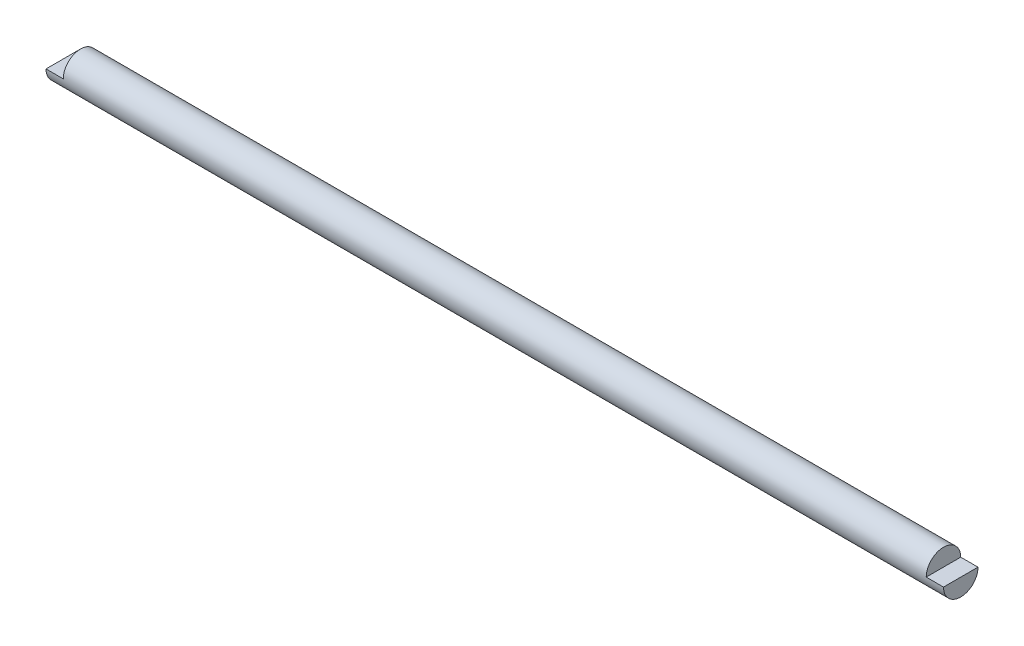
from build123d import *

# Parameters (mm, degrees)
SKETCH1_R               = 6.35
BOSS_EXTRUDE1_DEPTH     = 330.2
CUT_EXTRUDE1_DEPTH      = 331.322092812
CUT_EXTRUDE1_DEPTH_BACK = 331.322092812
SKETCH2_W               = 6.35
SKETCH2_H               = 6.35


with BuildPart() as part:
    # Sketch1 → Boss-Extrude1 (new body)
    with BuildSketch(Plane(origin=(0, 0, 0), x_dir=(0, 0, -1), z_dir=(1, 0, 0))):
        Circle(SKETCH1_R)
    extrude(amount=BOSS_EXTRUDE1_DEPTH)

    # Sketch2 → Cut-Extrude1 (cut, two sides: drawn at the far end of the back side and taken through both)
    with BuildSketch(Plane.XY.offset(-CUT_EXTRUDE1_DEPTH_BACK)):
        with Locations((3.175, 3.175)):
            Rectangle(SKETCH2_W, SKETCH2_H)
        with Locations((327.025, 3.175)):
            Rectangle(SKETCH2_W, SKETCH2_H)
    extrude(amount=CUT_EXTRUDE1_DEPTH + CUT_EXTRUDE1_DEPTH_BACK, mode=Mode.SUBTRACT)


solid = part.part
